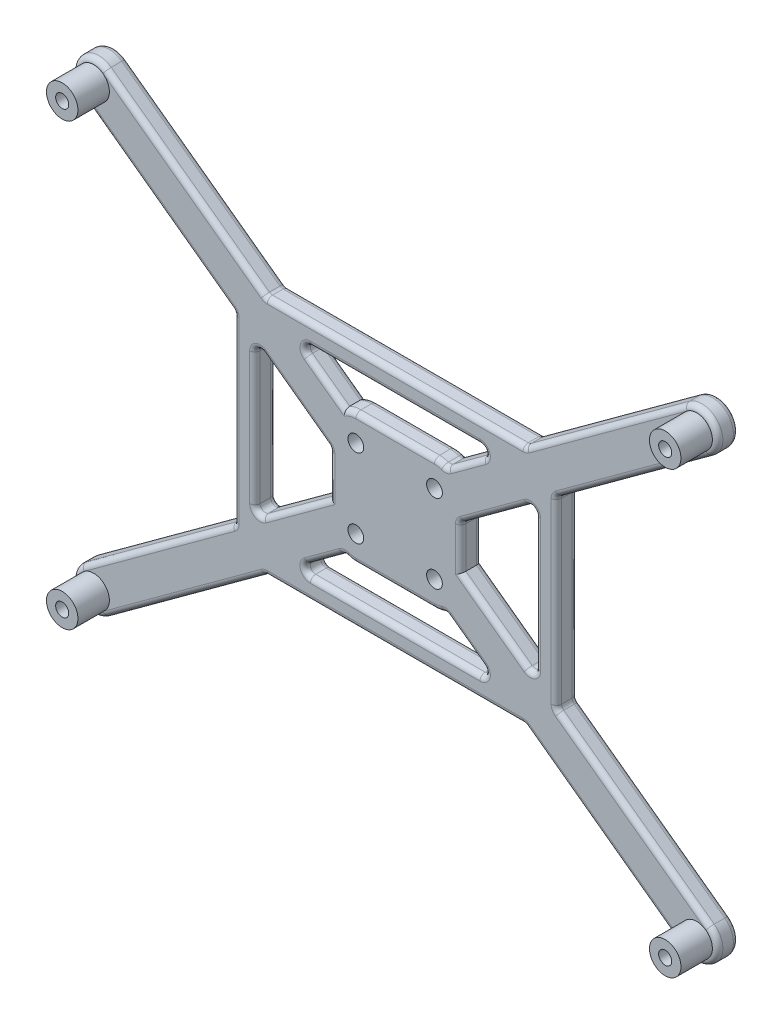
from build123d import *

# Parameters (mm, degrees)
SKETCH_1_R      = 3
SKETCH_1_R_2    = 1.5
EXTRUDE_3_DEPTH = 4
EXTRUDE_6_DEPTH = 4
SKETCH_1_6_R    = 3
SKETCH_1_6_R_2  = 1.25
EXTRUDE_7_DEPTH = 10
FILLET_1_R      = 1


# Read off the part's stored shape, not the designer's step: 凸台-拉伸6
with BuildPart() as part:
    # 草图1 → 凸台-拉伸3 (new body)
    with BuildSketch(Plane.XY):
        with BuildLine():
            Line((-52.665658217, -19.456575682), (-3.252455927, -19.456575682))
            Line((-3.252455927, -19.456575682), (27.181580849, -41.686654719))
            ThreePointArc((27.181580849, -41.686654719), (32.771021964, -40.815937761), (31.900305007, -35.226496646))
            Line((31.900305007, -35.226496646), (2.790942928, -13.964006084))
            Line((2.790942928, -13.964006084), (2.790942928, 21.050854719))
            Line((2.790942928, 21.050854719), (31.900305007, 42.313345281))
            ThreePointArc((31.900305007, 42.313345281), (32.771021964, 47.902786396), (27.181580849, 48.773503354))
            Line((27.181580849, 48.773503354), (-3.252455927, 26.543424318))
            Line((-3.252455927, 26.543424318), (-52.665658217, 26.543424318))
            Line((-52.665658217, 26.543424318), (-83.099694993, 48.773503354))
            ThreePointArc((-83.099694993, 48.773503354), (-88.689136108, 47.902786396), (-87.818419151, 42.313345281))
            Line((-87.818419151, 42.313345281), (-58.709057072, 21.050854719))
            Line((-58.709057072, 21.050854719), (-58.709057072, -13.964006084))
            Line((-58.709057072, -13.964006084), (-87.818419151, -35.226496646))
            ThreePointArc((-87.818419151, -35.226496646), (-88.689136108, -40.815937761), (-83.099694993, -41.686654719))
            Line((-83.099694993, -41.686654719), (-52.665658217, -19.456575682))
        make_face()
        with Locations((-85.459057072, -38.456575682)):
            Circle(SKETCH_1_R, mode=Mode.SUBTRACT)
        with Locations((-35.459057072, -3.956575682)):
            Circle(SKETCH_1_R_2, mode=Mode.SUBTRACT)
        with Locations((29.540942928, -38.456575682)):
            Circle(SKETCH_1_R, mode=Mode.SUBTRACT)
        Polygon((-27.959057072, -1.410014846), (-8.728646403, -15.456575682), (-47.189467741, -15.456575682), align=None, mode=Mode.SUBTRACT)
        with Locations((-20.459057072, -3.956575682)):
            Circle(SKETCH_1_R_2, mode=Mode.SUBTRACT)
        Polygon((-54.709057072, -11.042266954), (-54.709057072, 18.129115589), (-34.740551165, 3.543424318), align=None, mode=Mode.SUBTRACT)
        with Locations((-35.459057072, 11.043424318)):
            Circle(SKETCH_1_R_2, mode=Mode.SUBTRACT)
        with Locations((-85.459057072, 45.543424318)):
            Circle(SKETCH_1_R, mode=Mode.SUBTRACT)
        with Locations((-20.459057072, 11.043424318)):
            Circle(SKETCH_1_R_2, mode=Mode.SUBTRACT)
        Polygon((-1.209057072, -11.042266954), (-21.177562979, 3.543424318), (-1.209057072, 18.129115589), align=None, mode=Mode.SUBTRACT)
        Polygon((-8.728646403, 22.543424318), (-27.959057072, 8.496863481), (-47.189467741, 22.543424318), align=None, mode=Mode.SUBTRACT)
        with Locations((29.540942928, 45.543424318)):
            Circle(SKETCH_1_R, mode=Mode.SUBTRACT)
    extrude(amount=EXTRUDE_3_DEPTH)

    # 凸台-拉伸6 outline → 凸台-拉伸6 (add)
    with BuildSketch(Plane.XY):
        Polygon((-40.459057072, 7.720419937), (-40.459057072, -0.633571302), (-34.740551165, 3.543424318), align=None)
        with BuildLine():
            ThreePointArc((-18.29911589, 15.552820518), (-19.351578179, 15.919230969), (-20.459057072, 16.043424318))
            Line((-20.459057072, 16.043424318), (-35.459057072, 16.043424318))
            ThreePointArc((-35.459057072, 16.043424318), (-36.566535965, 15.919230969), (-37.618998253, 15.552820518))
            Line((-37.618998253, 15.552820518), (-27.959057072, 8.496863481))
            Line((-27.959057072, 8.496863481), (-18.29911589, 15.552820518))
        make_face()
        with BuildLine():
            Line((-35.459057072, -8.956575682), (-20.459057072, -8.956575682))
            ThreePointArc((-20.459057072, -8.956575682), (-19.351578179, -8.832382334), (-18.29911589, -8.465971883))
            Line((-18.29911589, -8.465971883), (-27.959057072, -1.410014846))
            Line((-27.959057072, -1.410014846), (-37.618998253, -8.465971883))
            ThreePointArc((-37.618998253, -8.465971883), (-36.566535965, -8.832382334), (-35.459057072, -8.956575682))
        make_face()
        Polygon((-21.177562979, 3.543424318), (-15.459057072, -0.633571302), (-15.459057072, 7.720419937), align=None)
    extrude(amount=EXTRUDE_6_DEPTH)

    # 草图1<6> → 凸台-拉伸7 (add)
    # profile 1 of 4: a face of its own
    with BuildSketch(Plane.XY):
        with Locations((-85.459057072, 45.543424318)):
            Circle(SKETCH_1_6_R)
        with Locations((-85.459057072, 45.543424318)):
            Circle(SKETCH_1_6_R_2, mode=Mode.SUBTRACT)
    # profile 2 of 4: a face of its own
    with BuildSketch(Plane.XY):
        with Locations((29.540942928, 45.543424318)):
            Circle(SKETCH_1_6_R)
        with Locations((29.540942928, 45.543424318)):
            Circle(SKETCH_1_6_R_2, mode=Mode.SUBTRACT)
    # profile 3 of 4: a face of its own
    with BuildSketch(Plane.XY):
        with Locations((29.540942928, -38.456575682)):
            Circle(SKETCH_1_6_R)
        with Locations((29.540942928, -38.456575682)):
            Circle(SKETCH_1_6_R_2, mode=Mode.SUBTRACT)
    # profile 4 of 4: a face of its own
    with BuildSketch(Plane.XY):
        with Locations((-85.459057072, -38.456575682)):
            Circle(SKETCH_1_6_R)
        with Locations((-85.459057072, -38.456575682)):
            Circle(SKETCH_1_6_R_2, mode=Mode.SUBTRACT)
    extrude(amount=EXTRUDE_7_DEPTH)

    # 圆角1
    fillet_1_edges = [part.edges().sort_by_distance(p)[0] for p in [
        (-73.263738111, -24.595251365, 4),
        (-88.689136108, -40.815937761, 4),
        (-67.882676605, -30.571615201, 4),
        (-27.959057072, -15.456575682, 4),
        (-1.209057072, 3.543424318, 4),
        (-27.959057072, 22.543424318, 4),
        (-42.404232997, 19.048122418, 4),
        (-47.584057072, -5.837919128, 0),
        (-47.584057072, -5.837919128, 4),
        (-54.709057072, 3.543424318, 4),
        (-13.513881147, 19.048122418, 0),
        (-13.513881147, 19.048122418, 4),
        (-18.29911589, 15.552820518, 2),
        (-13.513881146, -11.961273783, 0),
        (-13.513881146, -11.961273783, 4),
        (-18.29911589, -8.465971883, 2),
        (-42.404232997, -11.961273783, 0),
        (-42.404232997, -11.961273783, 4),
        (-37.618998253, -8.465971883, 2),
        (-8.334057072, 12.924767763, 0),
        (-8.334057072, 12.924767763, 4),
        (-15.459057072, 7.720419937, 2),
        (-47.584057072, 12.924767763, 4),
        (-8.334057072, -5.837919128, 0),
        (-8.334057072, -5.837919128, 4),
        (-15.459057072, 3.543424317, 4),
        (-19.351578179, -8.832382334, 0),
        (-40.459057072, 7.720419937, 2),
        (-40.459057072, 3.543424318, 0),
        (-36.566535965, -8.832382334, 4),
        (-27.959057072, -8.956575682, 4),
        (-19.351578179, -8.832382334, 4),
        (-40.459057072, 3.543424318, 4),
        (-15.459057072, 3.543424317, 0),
        (-36.566535965, -8.832382334, 0),
        (-27.959057072, -8.956575682, 0),
        (-19.351578179, 15.919230969, 0),
        (-27.959057072, 16.043424318, 4),
        (-36.566535965, 15.919230969, 0),
        (-19.351578179, 15.919230969, 4),
        (-36.566535965, 15.919230969, 4),
        (-27.959057072, 16.043424318, 0),
        (-27.959057072, -19.456575682, 4),
        (11.964562461, -30.571615201, 4),
        (32.771021964, -40.815937761, 4),
        (-47.584057072, 12.924767763, 0),
        (-54.709057072, 3.543424318, 0),
        (-42.404232997, 19.048122418, 0),
        (17.345623967, -24.595251365, 4),
        (-27.959057072, 22.543424318, 0),
        (-1.209057072, 3.543424318, 0),
        (-27.959057072, -15.456575682, 0),
        (-67.882676605, -30.571615201, 0),
        (-88.689136108, -40.815937761, 0),
        (2.790942928, 3.543424318, 4),
        (-73.263738111, -24.595251365, 0),
        (-58.709057072, 3.543424318, 0),
        (-73.263738111, 31.6821, 0),
        (-88.689136108, 47.902786396, 0),
        (-67.882676605, 37.658463836, 0),
        (-27.959057072, 26.543424318, 0),
        (11.964562461, 37.658463836, 0),
        (32.771021964, 47.902786396, 0),
        (17.345623967, 31.6821, 0),
        (2.790942928, 3.543424318, 0),
        (17.345623967, 31.6821, 4),
        (17.345623967, -24.595251365, 0),
        (32.771021964, -40.815937761, 0),
        (11.964562461, -30.571615201, 0),
        (-27.959057072, -19.456575682, 0),
        (32.771021964, 47.902786396, 4),
        (11.964562461, 37.658463836, 4),
        (-54.709057072, 18.129115589, 2),
        (-54.709057072, -11.042266954, 2),
        (-47.189467741, 22.543424318, 2),
        (-8.728646403, 22.543424318, 2),
        (-1.209057072, 18.129115589, 2),
        (-1.209057072, -11.042266954, 2),
        (-27.959057072, 26.543424318, 4),
        (-47.189467741, -15.456575682, 2),
        (-8.728646403, -15.456575682, 2),
        (-52.665658217, -19.456575682, 2),
        (-58.709057072, -13.964006084, 2),
        (-58.709057072, 21.050854719, 2),
        (-52.665658217, 26.543424318, 2),
        (-3.252455927, 26.543424318, 2),
        (2.790942928, 21.050854719, 2),
        (2.790942928, -13.964006084, 2),
        (-3.252455927, -19.456575682, 2),
        (-67.882676605, 37.658463836, 4),
        (-88.689136108, 47.902786396, 4),
        (-73.263738111, 31.6821, 4),
        (-58.709057072, 3.543424318, 4),
    ]]
    fillet(fillet_1_edges, radius=FILLET_1_R - 0.0001)  # a hair under: the kernel refuses the full size


solid = part.part
